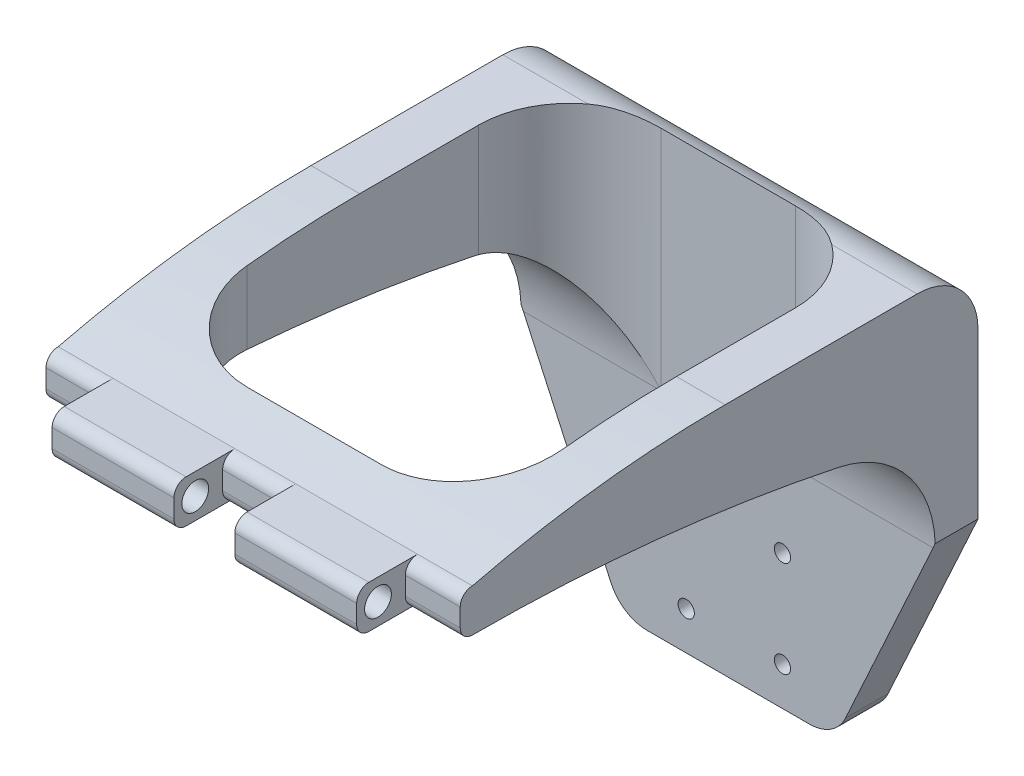
from build123d import *

# Parameters (mm, degrees)
BOSS_EXTRUDE2_DEPTH             = 6.35
BOSS_EXTRUDE2_DEPTH_BACK        = 2.54
SKETCH2_W                       = 86.35999999999999
SKETCH2_H                       = 132.07999999999998
SKETCH3_W                       = 86.35999999999999
SKETCH3_H                       = 8.889999999999999
BOSS_EXTRUDE3_DEPTH             = 101.6
SKETCH6_W                       = 25.39999999999999
SKETCH6_H                       = 8.89
BOSS_EXTRUDE4_DEPTH             = 6.35
CBORE_FOR_M3_SBHCS1_D           = 3.4
CBORE_FOR_M3_SBHCS1_CBORE_D     = 6.7
CBORE_FOR_M3_SBHCS1_CBORE_DEPTH = 2.666
CUT_EXTRUDE3_DEPTH              = 182.55670546691465
CUT_EXTRUDE3_DEPTH_BACK         = 182.55670546691465
SKETCH7_R                       = 2.7940000000000107
FILLET1_R                       = 2.5399999999999996
SKETCH11_W                      = 86.35999999999999
SKETCH11_H                      = 8.889999999999999
CUT_EXTRUDE4_DEPTH              = 22.86
SKETCH12_W                      = 11.429999999999993
SKETCH12_H                      = 8.89
SKETCH12_W_2                    = 11.429999999999998
CUT_EXTRUDE5_DEPTH              = 2.5399999999999996
MOVE_START                      = 11.43
MOVE_FACE1_DEPTH                = 25.4
MOVE_START_2                    = 49.53
MOVE_FACE1_2_DEPTH              = 25.4
SKETCH13_W                      = 86.35999999999999
SKETCH13_H                      = 78.74000000000001
CUT_EXTRUDE6_DEPTH              = 190.71096594556678
CUT_EXTRUDE7_DEPTH              = 192.9171289906141
FILLET8_R                       = 2.54
BOSS_EXTRUDE6_START             = -86.36
BOSS_EXTRUDE6_DEPTH             = 86.36
BOSS_EXTRUDE8_START             = -86.36
BOSS_EXTRUDE8_DEPTH             = 86.36
CUT_EXTRUDE8_DEPTH              = 169.1443549453861
CUT_EXTRUDE8_DEPTH_BACK         = 169.1443549453861
FILLET12_R                      = 19.05
FILLET13_R                      = 25.4
FILLET14_R                      = 8.255
FILLET16_R                      = 12.7


# Read off the part's stored shape, not the designer's step: Move Face1
with BuildPart() as part:
    # Sketch2 → Boss-Extrude2 (new, two sides: drawn at the far end of the back side and taken through both)
    with BuildSketch(Plane.XY.offset(-BOSS_EXTRUDE2_DEPTH_BACK)):
        with Locations((43.17999999999999, 66.03999999999999)):
            Rectangle(SKETCH2_W, SKETCH2_H)
    extrude(amount=BOSS_EXTRUDE2_DEPTH + BOSS_EXTRUDE2_DEPTH_BACK)

    # Sketch3 → Boss-Extrude3 (add)
    with BuildSketch(Plane.XY.offset(6.35)):
        Polygon((0, 132.07999999999998), (86.35999999999999, 132.07999999999998), (86.35999999999999, 123.18999999999998), (-3.27e-15, 123.18999999999998), align=None)
        with Locations((43.17999999999999, 4.444999999999999)):
            Rectangle(SKETCH3_W, SKETCH3_H)
    extrude(amount=BOSS_EXTRUDE3_DEPTH)

    # Sketch6 → Boss-Extrude4 (add)
    with BuildSketch(Plane.XY.offset(107.94999999999999)):
        with Locations((62.23, 127.63499999999999)):
            Rectangle(SKETCH6_W, SKETCH6_H)
        with Locations((24.129999999999995, 127.63499999999999)):
            Rectangle(SKETCH6_W, SKETCH6_H)
    extrude(amount=BOSS_EXTRUDE4_DEPTH)

    # CBORE for M3 SBHCS1 (through all)
    with Locations(Plane(origin=(0, 0, -2.54), x_dir=(1, 0, 0), z_dir=(0, 0, -1))):
        with Locations((34.417, -53.721), (54.483, -53.721), (34.417, -73.787), (54.483, -73.787)):
            CounterBoreHole(CBORE_FOR_M3_SBHCS1_D / 2, CBORE_FOR_M3_SBHCS1_CBORE_D / 2, CBORE_FOR_M3_SBHCS1_CBORE_DEPTH)

    # Sketch7 → Cut-Extrude3 (cut, two sides: drawn at the far end of the back side and taken through both)
    with BuildSketch(Plane.ZY.offset(-49.53).offset(-CUT_EXTRUDE3_DEPTH_BACK)):
        with Locations((111.12499999999999, 127.635)):
            Circle(SKETCH7_R)
    extrude(amount=CUT_EXTRUDE3_DEPTH + CUT_EXTRUDE3_DEPTH_BACK, mode=Mode.SUBTRACT)

    # Fillet1
    fillet1_edges = [part.edges().sort_by_distance(p)[0] for p in [
        (62.23, 123.18999999999998, 114.29999999999998),
        (62.23, 132.07999999999998, 114.29999999999998),
        (24.129999999999995, 123.18999999999998, 114.29999999999998),
        (24.129999999999995, 132.07999999999998, 114.29999999999998),
    ]]
    fillet(fillet1_edges, radius=FILLET1_R)

    # Sketch11 → Cut-Extrude4 (cut)
    with BuildSketch(Plane.XY.offset(107.94999999999999)):
        with Locations((43.17999999999999, 4.444999999999999)):
            Rectangle(SKETCH11_W, SKETCH11_H)
    extrude(amount=-CUT_EXTRUDE4_DEPTH, mode=Mode.SUBTRACT)

    # Sketch12 → Cut-Extrude5 (cut)
    with BuildSketch(Plane.XY.offset(107.94999999999999)):
        with Locations((80.64499999999998, 127.63499999999999)):
            Rectangle(SKETCH12_W, SKETCH12_H)
        Polygon((49.53, 123.18999999999998), (36.82999999999999, 123.18999999999997), (36.82999999999999, 132.07999999999998), (49.53, 132.07999999999998), align=None)
        with Locations((5.714999999999999, 127.63499999999999)):
            Rectangle(SKETCH12_W_2, SKETCH12_H)
    extrude(amount=-CUT_EXTRUDE5_DEPTH, mode=Mode.SUBTRACT)

    # Move Face1 outline → Move Face1 (add)
    with BuildSketch(Plane.YZ.offset(MOVE_START)):
        with BuildLine():
            ThreePointArc((132.08, 113.03), (131.336051224, 114.826051224), (129.54, 115.57))
            Line((129.54, 115.57), (125.73, 115.57))
            ThreePointArc((125.73, 115.57), (123.933948776, 114.826051224), (123.19, 113.03))
            Line((123.19, 113.03), (123.19, 111.76))
            ThreePointArc((123.19, 111.76), (123.933948776, 113.556051224), (125.73, 114.3))
            Line((125.73, 114.3), (129.54, 114.3))
            ThreePointArc((129.54, 114.3), (131.336051224, 113.556051224), (132.08, 111.76))
            Line((132.08, 111.76), (132.08, 113.03))
        make_face()
    extrude(amount=MOVE_FACE1_DEPTH)

    # Move Face1 2 outline → Move Face1 2 (add)
    with BuildSketch(Plane.YZ.offset(MOVE_START_2)):
        with BuildLine():
            ThreePointArc((132.08, 113.03), (131.336051224, 114.826051224), (129.54, 115.57))
            Line((129.54, 115.57), (125.73, 115.57))
            ThreePointArc((125.73, 115.57), (123.933948776, 114.826051224), (123.19, 113.03))
            Line((123.19, 113.03), (123.19, 111.76))
            ThreePointArc((123.19, 111.76), (123.933948776, 113.556051224), (125.73, 114.3))
            Line((125.73, 114.3), (129.54, 114.3))
            ThreePointArc((129.54, 114.3), (131.336051224, 113.556051224), (132.08, 111.76))
            Line((132.08, 111.76), (132.08, 113.03))
        make_face()
    extrude(amount=MOVE_FACE1_2_DEPTH)

    # Sketch13 → Cut-Extrude6 (cut, through all)
    with BuildSketch(Plane(origin=(0, 8.889999999999999, 0), x_dir=(1, 0, 0), z_dir=(0, 1, 0))):
        with Locations((43.17999999999999, -45.72)):
            Rectangle(SKETCH13_W, SKETCH13_H)
    extrude(amount=-CUT_EXTRUDE6_DEPTH, mode=Mode.SUBTRACT)

    # Sketch14 → Cut-Extrude7 (cut, through all)
    with BuildSketch(Plane.XY.offset(6.35)):
        Polygon((86.35999999999999, 91.43999999999998), (65.40499999999999, 45.71999999999999), (20.955, 45.71999999999999), (3.89e-15, 91.43999999999998), (0, 0), (86.35999999999999, 0), align=None)
    extrude(amount=-CUT_EXTRUDE7_DEPTH, mode=Mode.SUBTRACT)

    # Fillet8
    fillet8_edges = [part.edges().sort_by_distance(p)[0] for p in [
        (80.64499999999998, 123.18999999999998, 105.40999999999998),
        (80.64499999999998, 132.07999999999998, 105.40999999999998),
        (43.17999999999999, 123.18999999999997, 105.40999999999998),
        (43.17999999999999, 132.07999999999998, 105.40999999999998),
        (5.714999999999999, 123.18999999999998, 105.40999999999998),
        (5.714999999999999, 132.07999999999998, 105.40999999999998),
    ]]
    fillet(fillet8_edges, radius=FILLET8_R)

    # Sketch17 → Boss-Extrude6 (add)
    with BuildSketch(Plane(origin=(86.35999999999999, 0, 0), x_dir=(0, 0, -1), z_dir=(1, 0, 0)).offset(BOSS_EXTRUDE6_START)):
        with BuildLine():
            Line((-102.86999999999999, 132.07999999999998), (2.5400000000000063, 132.07999999999998))
            Line((2.54, 132.07999999999998), (2.5400000000000005, 138.42999999999998))
            Line((2.539999999999999, 138.42999999999998), (-50.165, 138.42999999999998))
            ThreePointArc((-50.16499999999999, 138.43), (-76.70777431972341, 136.8342768537044), (-102.86999999999999, 132.07999999999998))
        make_face()
    extrude(amount=BOSS_EXTRUDE6_DEPTH)

    # Sketch20 → Boss-Extrude8 (add)
    with BuildSketch(Plane.ZY.offset(BOSS_EXTRUDE8_START)):
        with BuildLine():
            Line((6.35, 110.48999999999998), (6.35, 123.18999999999998))
            Line((6.35, 123.18999999999998), (102.86999999999999, 123.18999999999998))
            ThreePointArc((102.86999999999999, 123.18999999999998), (54.19402954228848, 120.00137547860714), (6.35, 110.48999999999998))
        make_face()
    extrude(amount=BOSS_EXTRUDE8_DEPTH)

    # Sketch16 → Cut-Extrude8 (cut, two sides: drawn at the far end of the back side and taken through both)
    with BuildSketch(Plane(origin=(0, 132.07999999999998, 0), x_dir=(1, 0, 0), z_dir=(0, 1, 0)).offset(-CUT_EXTRUDE8_DEPTH_BACK)):
        Polygon((10.160000000000016, -92.71), (10.160000000000016, -6.350000000000009), (76.19999999999999, -6.350000000000002), (76.19999999999999, -92.71), align=None)
    extrude(amount=CUT_EXTRUDE8_DEPTH + CUT_EXTRUDE8_DEPTH_BACK, mode=Mode.SUBTRACT)

    # Fillet12
    fillet12_edges = [part.edges().sort_by_distance(p)[0] for p in [
        (10.160000000000016, 128.681636078935, 92.71),
        (76.19999999999999, 124.45999999999998, 6.350000000000002),
        (76.19999999999999, 128.681636078935, 92.71),
        (10.160000000000016, 124.45999999999998, 6.350000000000009),
    ]]
    fillet(fillet12_edges, radius=FILLET12_R)

    # Fillet13
    fillet13_edges = [part.edges().sort_by_distance(p)[0] for p in [
        (71.755, 110.49000000000001, 6.349999999999991),
        (14.605000000000006, 110.49000000000001, 6.349999999999989),
    ]]
    fillet(fillet13_edges, radius=FILLET13_R)

    # Fillet14
    fillet14_edges = [part.edges().sort_by_distance(p)[0] for p in [
        (20.955, 45.71999999999999, 1.9049999999999994),
        (65.40499999999999, 45.71999999999999, 1.9049999999999994),
    ]]
    fillet(fillet14_edges, radius=FILLET14_R)

    # Fillet16
    # the kernel refuses this fillet: 12.7 mm, written as the material it takes off along each edge
    with BuildSketch(Plane(origin=(-31.750000000000018, 138.42999999999998, -2.5400000000000005), x_dir=(0, 0, 1), z_dir=(1, 0, 0))) as fillet16_piece_1:
        with BuildLine():
            CenterArc((FILLET16_R, FILLET16_R), FILLET16_R, 180, 90)
            Line((3.11e-15, FILLET16_R), (0, 0))
            Line((0, 0), (FILLET16_R, 0))
        make_face()
    extrude(amount=149.86, mode=Mode.SUBTRACT)


solid = part.part
